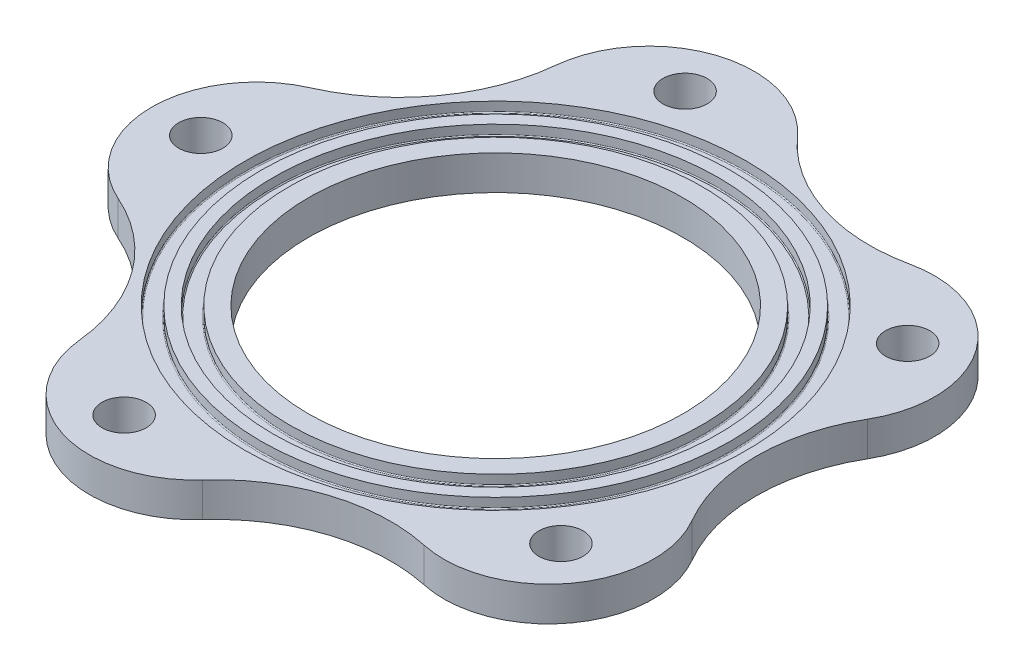
from build123d import *

# Parameters (mm, degrees)
SKETCH1_R           = 70
SKETCH1_R_2         = 38.1
BOSS_EXTRUDE3_DEPTH = 7
CUT_EXTRUDE8_DEPTH  = 100.242128151
SKETCH10_R          = 4.5
CUT_EXTRUDE10_DEPTH = 98.577177712
CIRPATTERN1_COUNT   = 5
SKETCH9_R           = 51
SKETCH9_R_2         = 47.75
SKETCH9_R_3         = 45.25
SKETCH9_R_4         = 42
CUT_EXTRUDE9_DEPTH  = 2
FILLET1_R           = 0.2


with BuildPart() as part:
    # Sketch1 → Boss-Extrude3 (new body)
    with BuildSketch(Plane(origin=(0, 0, 0), x_dir=(1, 0, 0), z_dir=(0, 1, 0))):
        Circle(SKETCH1_R)
        Circle(SKETCH1_R_2, mode=Mode.SUBTRACT)
    extrude(amount=BOSS_EXTRUDE3_DEPTH)

    # Sketch7 → Cut-Extrude8 (cut, through all)
    with BuildSketch(Plane(origin=(0, 0, 0), x_dir=(1, 0, 0), z_dir=(0, 1, 0))):
        with BuildLine():
            ThreePointArc((-36.27227954, -48.438220475), (-42.877900702, -31.152618372), (-57.276236023, -19.528754514))
            ThreePointArc((-57.276236023, -19.528754514), (-66.538417314, -11.654038204), (-70, -8.3e-08))
            ThreePointArc((-70, -8.3e-08), (-56.631189749, -41.144967464), (-21.631190148, -66.573955965))
            ThreePointArc((-21.631190148, -66.573955965), (-31.645150857, -59.680499323), (-36.27227954, -48.438220475))
        make_face()
        with BuildLine():
            ThreePointArc((-21.631189722, 66.573956103), (-56.631189666, 41.144967578), (-70, -8.3e-08))
            ThreePointArc((-70, -8.3e-08), (-66.538417359, 11.654038134), (-57.276236023, 19.528754514))
            ThreePointArc((-57.276236023, 19.528754514), (-42.877900702, 31.152618372), (-36.27227954, 48.438220475))
            ThreePointArc((-36.27227954, 48.438220475), (-31.645150716, 59.680499497), (-21.631189722, 66.573956103))
        make_face()
        with BuildLine():
            ThreePointArc((0.87361893, -60.507654522), (-9.477853069, -66.883091313), (-21.631190148, -66.573955965))
            ThreePointArc((-21.631190148, -66.573955965), (21.631189196, -66.573956274), (56.631189434, -41.144967898))
            ThreePointArc((56.631189434, -41.144967898), (46.980638501, -48.538615406), (34.858734418, -49.465221122))
            ThreePointArc((34.858734418, -49.465221122), (16.377900702, -50.405995364), (0.87361893, -60.507654522))
        make_face()
        with BuildLine():
            ThreePointArc((56.631189858, 41.144967314), (21.631189752, 66.573956093), (-21.631189722, 66.573956103))
            ThreePointArc((-21.631189722, 66.573956103), (-9.477852853, 66.883091255), (0.87361893, 60.507654522))
            ThreePointArc((0.87361893, 60.507654522), (16.377900702, 50.405995364), (34.858734418, 49.465221122))
            ThreePointArc((34.858734418, 49.465221122), (46.980638838, 48.538615277), (56.631189858, 41.144967314))
        make_face()
        with BuildLine():
            ThreePointArc((57.816162215, -17.867032561), (60.680782162, -29.681985636), (56.631189434, -41.144967898))
            ThreePointArc((56.631189434, -41.144967898), (70, -3.61e-07), (56.631189858, 41.144967314))
            ThreePointArc((56.631189858, 41.144967314), (60.68078218, 29.681985276), (57.816162215, 17.867032561))
            ThreePointArc((57.816162215, 17.867032561), (53, 0), (57.816162215, -17.867032561))
        make_face()
    extrude(amount=CUT_EXTRUDE8_DEPTH, mode=Mode.SUBTRACT)

    # Sketch10 → Cut-Extrude10 (cut, through all)
    with BuildSketch(Plane.XZ):
        with Locations((-60, 0)):
            Circle(SKETCH10_R)
    cut_extrude10 = extrude(amount=-CUT_EXTRUDE10_DEPTH, mode=Mode.SUBTRACT)

    # CirPattern1: Cut-Extrude10 ×5 about axis
    cirpattern1_axis = Axis((0, -6.755914423, 0), (0, 1, 0))
    for i in range(1, CIRPATTERN1_COUNT):
        add(cut_extrude10.rotate(cirpattern1_axis, i * 360 / CIRPATTERN1_COUNT), mode=Mode.SUBTRACT)

    # Sketch9 → Cut-Extrude9 (cut)
    # profile 1 of 2: a face of its own
    with BuildSketch(Plane(origin=(0, 7, 0), x_dir=(1, 0, 0), z_dir=(0, 1, 0))):
        Circle(SKETCH9_R)
        Circle(SKETCH9_R_2, mode=Mode.SUBTRACT)
    # profile 2 of 2: a face of its own
    with BuildSketch(Plane(origin=(0, 7, 0), x_dir=(1, 0, 0), z_dir=(0, 1, 0))):
        Circle(SKETCH9_R_3)
        Circle(SKETCH9_R_4, mode=Mode.SUBTRACT)
    extrude(amount=-CUT_EXTRUDE9_DEPTH, mode=Mode.SUBTRACT)

    # Fillet1
    fillet1_edges = [part.edges().sort_by_distance(p)[0] for p in [
        (-45.25, 5, 0),
        (-42, 5, 0),
        (-51, 5, 0),
        (-47.75, 5, 0),
    ]]
    fillet(fillet1_edges, radius=FILLET1_R)


solid = part.part
